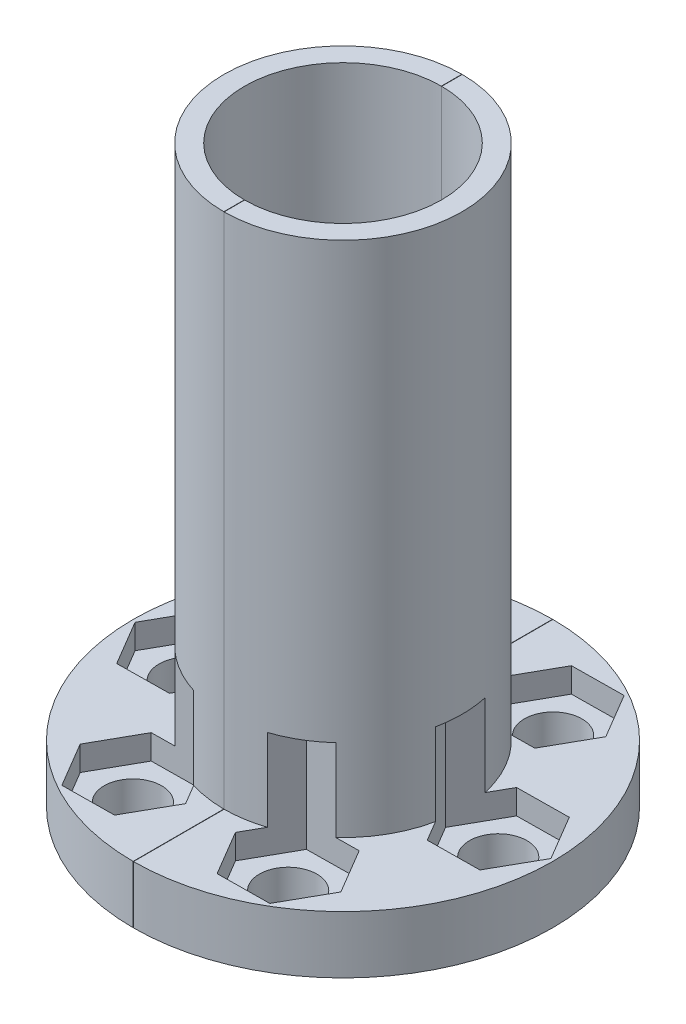
from build123d import *

# Parameters (mm, degrees)
BOSS_EXTRUDE1_OUTLINE_R = 1.75
BOSS_EXTRUDE1_DEPTH     = 3.5
BOSS_EXTRUDE2_DEPTH     = 35
CUT_EXTRUDE1_DEPTH      = 5
CUT_EXTRUDE1_DEPTH_BACK = 1.5


# Read off the part's stored shape, not the designer's step: Boss-Extrude1
with BuildPart() as part:
    # Boss-Extrude1 outline → Boss-Extrude1 (new body)
    # profile 1 of 2: a face of its own
    with BuildSketch(Plane(origin=(0, 0, 0), x_dir=(1, 0, 0), z_dir=(0, 1, 0))):
        with BuildLine():
            Line((-0.01, 5.999991667), (-0.01, 12.769996085))
            ThreePointArc((-0.01, 12.769996085), (-12.77, 0), (-0.01, -12.769996085))
            Line((-0.01, -12.769996085), (-0.01, -5.999991667))
            ThreePointArc((-0.01, -5.999991667), (-6, 0), (-0.01, 5.999991667))
        make_face()
        with Locations((-4.632438453, -8.162030322)):
            Circle(BOSS_EXTRUDE1_OUTLINE_R, mode=Mode.SUBTRACT)
        with Locations((-9.384744832, -0.069205779)):
            Circle(BOSS_EXTRUDE1_OUTLINE_R, mode=Mode.SUBTRACT)
        with Locations((-4.752306379, 8.092824543)):
            Circle(BOSS_EXTRUDE1_OUTLINE_R, mode=Mode.SUBTRACT)
    # profile 2 of 2: a face of its own
    with BuildSketch(Plane(origin=(0, 0, 0), x_dir=(1, 0, 0), z_dir=(0, 1, 0))):
        with BuildLine():
            ThreePointArc((0.01, 5.999991667), (6, 0), (0.01, -5.999991667))
            Line((0.01, -5.999991667), (0.01, -12.769996085))
            ThreePointArc((0.01, -12.769996085), (12.77, 0), (0.01, 12.769996085))
            Line((0.01, 12.769996085), (0.01, 5.999991667))
        make_face()
        with Locations((4.752306379, -8.092824543)):
            Circle(BOSS_EXTRUDE1_OUTLINE_R, mode=Mode.SUBTRACT)
        with Locations((9.384744832, 0.069205779)):
            Circle(BOSS_EXTRUDE1_OUTLINE_R, mode=Mode.SUBTRACT)
        with Locations((4.632438453, 8.162030322)):
            Circle(BOSS_EXTRUDE1_OUTLINE_R, mode=Mode.SUBTRACT)
    extrude(amount=BOSS_EXTRUDE1_DEPTH)

    # Sketch2<3> → Boss-Extrude2 (add)
    with BuildSketch(Plane(origin=(0, 0, 0), x_dir=(1, 0, 0), z_dir=(0, 1, 0))):
        with BuildLine():
            ThreePointArc((-0.01, -5.999991667), (-6, 0), (-0.01, 5.999991667))
            Line((-0.01, 5.999991667), (-0.01, 7.249993103))
            ThreePointArc((-0.01, 7.249993103), (-7.25, 0), (-0.01, -7.249993103))
            Line((-0.01, -7.249993103), (-0.01, -5.999991667))
        make_face()
        with BuildLine():
            Line((0.01, 7.249993103), (0.01, 5.999991667))
            ThreePointArc((0.01, 5.999991667), (6, 0), (0.01, -5.999991667))
            Line((0.01, -5.999991667), (0.01, -7.249993103))
            ThreePointArc((0.01, -7.249993103), (7.25, 0), (0.01, 7.249993103))
        make_face()
    extrude(amount=BOSS_EXTRUDE2_DEPTH)

    # Sketch3 → Cut-Extrude1 (cut, two sides: drawn at the far end of the back side and taken through both)
    with BuildSketch(Plane(origin=(0, 3.5, 0), x_dir=(1, 0, 0), z_dir=(0, 1, 0)).offset(-CUT_EXTRUDE1_DEPTH_BACK)):
        Polygon((6.249885019, 5.429412541), (7.807678154, 8.196471247), (6.190231587, 10.929089028), (3.014991887, 10.894648103), (1.457198752, 8.127589397), (3.074645319, 5.394971616), align=None)
        Polygon((-3.194513245, 10.859883249), (-6.369752945, 10.825442324), (-7.927546079, 8.058383618), (-6.310099513, 5.325765836), (-3.134859812, 5.360206762), (-1.577066678, 8.127265468), align=None)
        Polygon((7.826951698, -2.697852927), (11.002191398, -2.663412002), (12.559984532, 0.103646704), (10.942537966, 2.836264486), (7.767298265, 2.80182356), (6.209505131, 0.034764854), align=None)
        Polygon((1.577066678, -8.127265468), (3.194513245, -10.859883249), (6.369752945, -10.825442324), (7.927546079, -8.058383618), (6.310099513, -5.325765836), (3.134859812, -5.360206762), align=None)
        Polygon((-6.249885019, -5.429412541), (-7.807678154, -8.196471247), (-6.190231587, -10.929089028), (-3.014991887, -10.894648103), (-1.457198752, -8.127589397), (-3.074645319, -5.394971616), align=None)
        Polygon((-7.826951698, 2.697852927), (-11.002191398, 2.663412002), (-12.559984532, -0.103646704), (-10.942537966, -2.836264486), (-7.767298265, -2.80182356), (-6.209505131, -0.034764854), align=None)
    extrude(amount=CUT_EXTRUDE1_DEPTH + CUT_EXTRUDE1_DEPTH_BACK, mode=Mode.SUBTRACT)


solid = part.part
